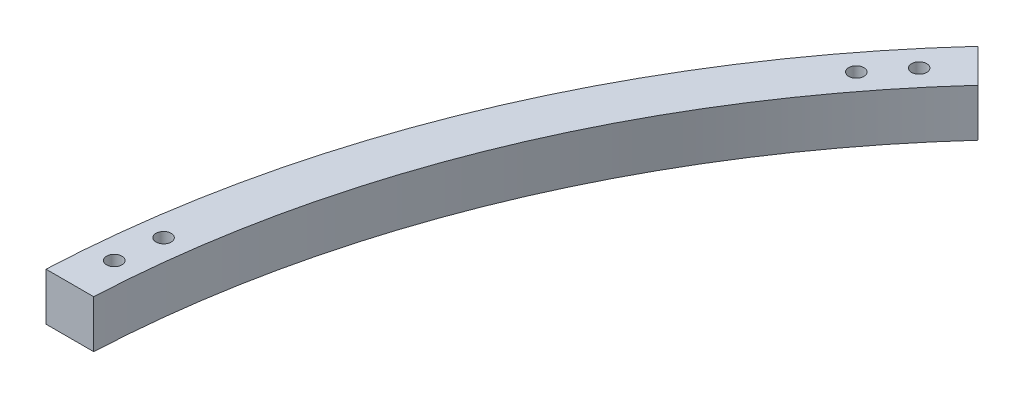
from build123d import *

# Parameters (mm, degrees)
BASE_DEPTH                 = 5
F_3_1_3_2_DIAMETER_HOLE1_D = 3.2


with BuildPart() as part:
    # Sketch1 → base (new, symmetric)
    with BuildSketch(Plane(origin=(0, 0, 0), x_dir=(1, 0, 0), z_dir=(0, 1, 0))):
        with BuildLine():
            Line((-155.395037554, 141.25290193), (-162.473770491, 148.331634867))
            ThreePointArc((-162.473770491, 148.331634867), (-203.253497152, 84.19035512), (-219.772609758, 10))
            Line((-219.772609758, 10), (-209.761769634, 10))
            ThreePointArc((-209.761769634, 10), (-194.014701827, 80.363520797), (-155.395037554, 141.25290193))
        make_face()
    extrude(amount=BASE_DEPTH, both=True)

    # Ø3.1 (3.2) Diameter Hole1 (through all)
    with Locations(Plane(origin=(0, 5, 0), x_dir=(1, 0, 0), z_dir=(0, 1, 0))):
        with Locations((-214.18186009, 18.738484691), (-164.699555271, 138.199336083), (-170.570968163, 130.883707237), (-213.160645195, 28.063131327)):
            Hole(F_3_1_3_2_DIAMETER_HOLE1_D / 2)


solid = part.part
